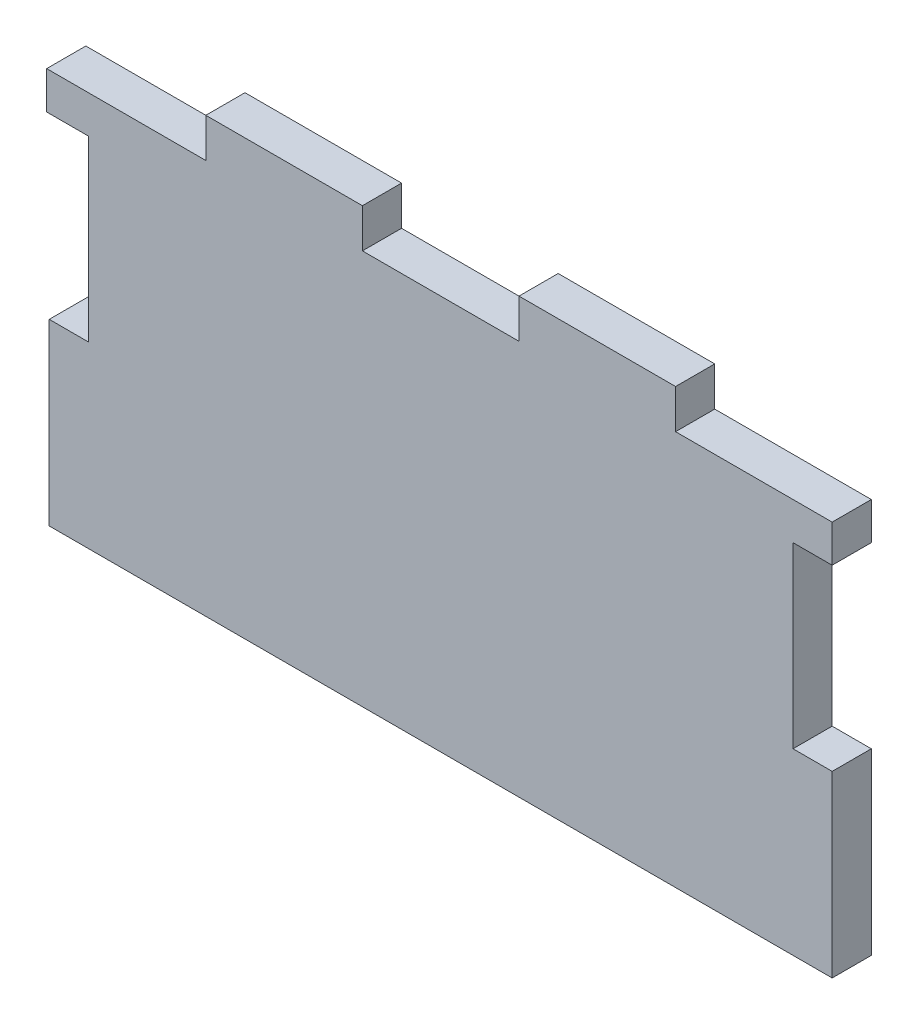
from build123d import *

# Parameters (mm, degrees)
SKETCH2_W             = 127
SKETCH2_H             = 152.4
BOSS_EXTRUDE2_DEPTH   = 6.35
SKETCH3_W             = 127
SKETCH3_H             = 65.278
CUT_EXTRUDE1_DEPTH    = 100.3932216
CAVITY1_START         = -63.5
CAVITY1_OUTLINE_W     = 28.919714286
CAVITY1_OUTLINE_H     = 6.35
CAVITY1_OUTLINE_W_2   = 29.028571429
CAVITY1_DEPTH         = 6.35
CAVITY1_START_2       = 57.15
CAVITY1_2_OUTLINE_W   = 28.919714286
CAVITY1_2_OUTLINE_H   = 6.35
CAVITY1_2_OUTLINE_W_2 = 29.028571429
CAVITY1_2_DEPTH       = 6.35
CUT_EXTRUDE2_DEPTH    = 100.3932216
BOSS_EXTRUDE3_DEPTH   = 6.35
CAVITY2_START         = 17.018
CAVITY2_OUTLINE_W     = 20.9
CAVITY2_OUTLINE_H     = 9
CAVITY2_OUTLINE_W_2   = 25.4
CAVITY2_OUTLINE_W_3   = 19.05
CAVITY2_DEPTH         = 6.35
SKETCH6_W             = 6.35
SKETCH6_H             = 6.059714286
BOSS_EXTRUDE4_DEPTH   = 6.35
SKETCH7_W             = 114.3
SKETCH7_H             = 29.173714286
CUT_EXTRUDE3_DEPTH    = 100.658360693


# Read off the part's stored shape, not the designer's step: Cavity1, Cavity2
with BuildPart() as part:
    # Sketch2 → Boss-Extrude2 (new body)
    with BuildSketch(Plane.XY):
        Rectangle(SKETCH2_W, SKETCH2_H)
    extrude(amount=BOSS_EXTRUDE2_DEPTH)

    # Sketch3 → Cut-Extrude1 (cut, through all)
    with BuildSketch(Plane.XY.offset(6.35)):
        with Locations((0, 43.561)):
            Rectangle(SKETCH3_W, SKETCH3_H)
    extrude(amount=-CUT_EXTRUDE1_DEPTH, mode=Mode.SUBTRACT)

    # Cavity1 outline → Cavity1 (cut)
    with BuildSketch(Plane.YZ.offset(CAVITY1_START)):
        with Locations((-3.537857143, 3.175)):
            Rectangle(CAVITY1_OUTLINE_W, CAVITY1_OUTLINE_H)
        with Locations((-61.540571429, 3.175)):
            Rectangle(CAVITY1_OUTLINE_W_2, CAVITY1_OUTLINE_H)
    extrude(amount=CAVITY1_DEPTH, mode=Mode.SUBTRACT)

    # Cavity1 2 outline → Cavity1 2 (cut)
    with BuildSketch(Plane.YZ.offset(CAVITY1_START_2)):
        with Locations((-3.537857143, 3.175)):
            Rectangle(CAVITY1_2_OUTLINE_W, CAVITY1_2_OUTLINE_H)
        with Locations((-61.540571429, 3.175)):
            Rectangle(CAVITY1_2_OUTLINE_W_2, CAVITY1_2_OUTLINE_H)
    extrude(amount=CAVITY1_2_DEPTH, mode=Mode.SUBTRACT)

    # Sketch4 → Cut-Extrude2 (cut, through all)
    with BuildSketch(Plane(origin=(0, 0, 0), x_dir=(-1, 0, 0), z_dir=(0, 0, -1))):
        Polygon((-57.15, -76.054857143), (-57.15, -79.645008966), (-65.377811093, -79.645008966), (-65.377811093, -73.782579567), (-57.15, -73.782579567), align=None)
        Polygon((57.15, -76.054857143), (57.15, -79.645008966), (65.72742819, -79.645008966), (65.72742819, -72.849920344), (57.15, -72.849920344), align=None)
    extrude(amount=-CUT_EXTRUDE2_DEPTH, mode=Mode.SUBTRACT)

    # Sketch5 → Boss-Extrude3 (add, through all)
    with BuildSketch(Plane(origin=(0, 0, 0), x_dir=(-1, 0, 0), z_dir=(0, 0, -1))):
        Polygon((-57.15, 10.922), (-57.15, 23.368), (57.995680603, 23.368), (57.15, 10.922), align=None)
    extrude(amount=-BOSS_EXTRUDE3_DEPTH)

    # Cavity2 outline → Cavity2 (cut)
    with BuildSketch(Plane(origin=(0, 0, 0), x_dir=(1, 0, 0), z_dir=(0, 1, 0)).offset(CAVITY2_START)):
        with Locations((-48.55, -3.5)):
            Rectangle(CAVITY2_OUTLINE_W, CAVITY2_OUTLINE_H)
        with Locations((0, -3.5)):
            Rectangle(CAVITY2_OUTLINE_W_2, CAVITY2_OUTLINE_H)
        with Locations((47.625, -3.5)):
            Rectangle(CAVITY2_OUTLINE_W_3, CAVITY2_OUTLINE_H)
    extrude(amount=CAVITY2_DEPTH, mode=Mode.SUBTRACT)

    # Sketch6 → Boss-Extrude4 (add, through all)
    with BuildSketch(Plane.XY.offset(6.35)):
        with Locations((60.325, 13.988142857)):
            Rectangle(SKETCH6_W, SKETCH6_H)
        Polygon((-63.914210908, 17.018), (-57.564210908, 17.018), (-57.15, 10.922), (-63.914210908, 10.922), align=None)
    extrude(amount=-BOSS_EXTRUDE4_DEPTH)

    # Sketch7 → Cut-Extrude3 (cut, through all)
    with BuildSketch(Plane(origin=(0, 0, 0), x_dir=(-1, 0, 0), z_dir=(0, 0, -1))):
        with Locations((0, -61.613142857)):
            Rectangle(SKETCH7_W, SKETCH7_H)
    extrude(amount=-CUT_EXTRUDE3_DEPTH, mode=Mode.SUBTRACT)


solid = part.part
